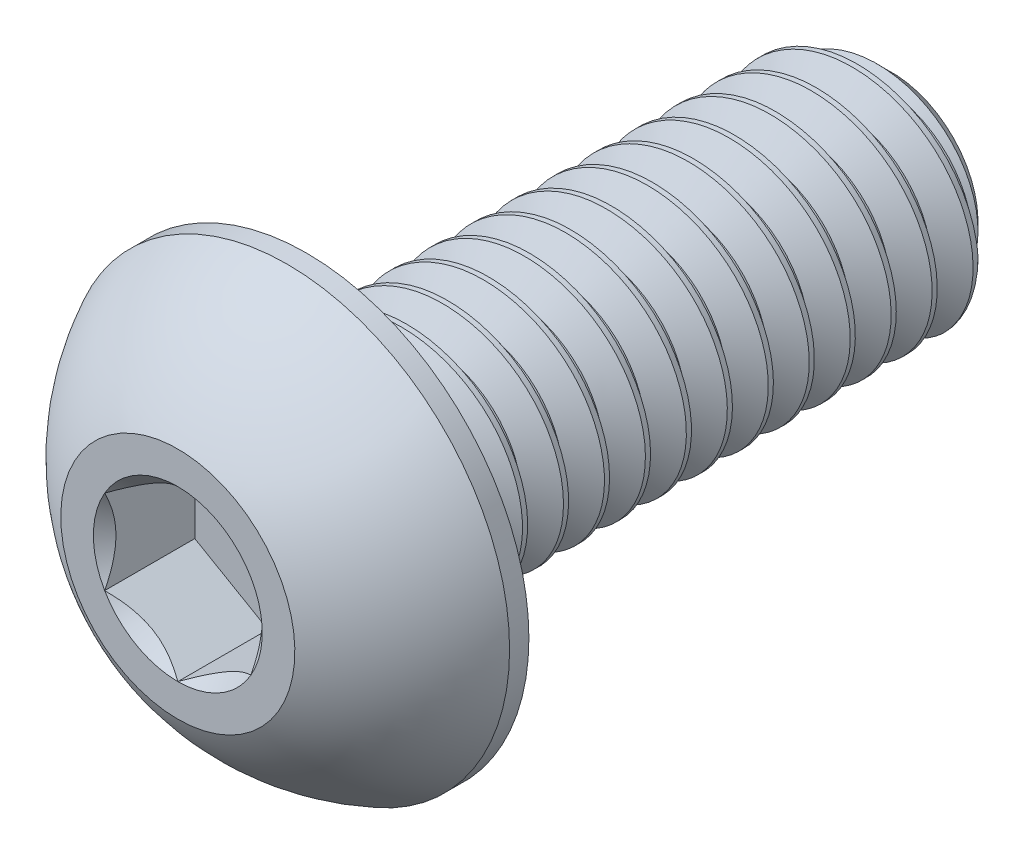
from build123d import *

# Parameters (mm, degrees)
CUT_EXTRUDE2_DEPTH = 1.54
CUT_SWEEP2_PITCH   = 0.7
CUT_SWEEP2_TO      = 10


with BuildPart() as part:
    # Sketch10 → Revolve3 (revolve)
    with BuildSketch(Plane(origin=(0, 0, 0), x_dir=(0, 0, -1), z_dir=(1, 0, 0)), mode=Mode.PRIVATE) as revolve3_sk:
        Polygon((4.475, 2), (5, 1.475), (5, 0), (-5, 0), (-5, 2), align=None)
    revolve(revolve3_sk.sketch.rotate(Axis((0, 0, 7.2), (0, 0, -1)), 180), axis=Axis((0, 0, 7.2), (0, 0, -1)))

    # Sketch7 → Revolve2 (revolve)
    with BuildSketch(Plane(origin=(0, 0, 0), x_dir=(0, 0, -1), z_dir=(1, 0, 0)), mode=Mode.PRIVATE) as revolve2_sk:
        with BuildLine():
            Line((-5.33, 3.8), (-5, 3.8))
            Line((-5, 3.8), (-5, 0))
            Line((-5, 0), (-7.2, 0))
            Line((-7.2, 0), (-7.2, 2))
            ThreePointArc((-7.2, 2), (-6.406499853, 3.047002626), (-5.33, 3.8))
        make_face()
    revolve(revolve2_sk.sketch.rotate(Axis((0, 0, 7.2), (0, 0, -1)), 180), axis=Axis((0, 0, 7.2), (0, 0, -1)))

    # Sketch5 → Cut-Extrude2 (cut)
    with BuildSketch(Plane.XY.offset(7.2)):
        Polygon((1.25, -0.721687836), (1.25, 0.721687836), (0, 1.443375673), (-1.25, 0.721687836), (-1.25, -0.721687836), (0, -1.443375673), align=None)
    extrude(amount=-CUT_EXTRUDE2_DEPTH, mode=Mode.SUBTRACT)

    # Cut-Extrude3 cone 1 section (through the dimple's axis) → Cut-Extrude3 (revolve, cut)
    with BuildSketch(Plane(origin=(0, 0, 7.2), x_dir=(0, -1, 0), z_dir=(1, 0, 0))):
        Polygon((0, 0), (1.443375673, 0), (0, 1.443375673), align=None)
    revolve(axis=Axis((0, 0, 7.2), (0, 0, -1)), mode=Mode.SUBTRACT)


with BuildPart() as body_2:
    # Split1: read off the stored shape, not the designer's step
    # Split1: the piece on the far side of the plane
    add(part.part)
    split(bisect_by=Plane.XY.offset(5), keep=Keep.BOTTOM)

    # Cut-Sweep2: arcs per turn and ends read off the stored shape
    # Cut-Sweep2: the profile of Sketch12 screwed along a right-hand helix through 19 turns, 6 arcs to a turn; built about Z, then put on its axis
    cut_sweep2_z = Axis((0, 0, 0), (0, 0, 1))
    cut_sweep2_corners = [(1.545336663, 0, -0.2625), (1.545336663, 0, -0.35), (2.037888611, 0, -0.634375), (2.037888611, 0, 0.021875)]
    with BuildLine(mode=Mode.PRIVATE) as cut_sweep2_profile:
        Line(cut_sweep2_corners[0], cut_sweep2_corners[1])
        Line(cut_sweep2_corners[1], cut_sweep2_corners[2])
        Line(cut_sweep2_corners[2], cut_sweep2_corners[3])
        Line(cut_sweep2_corners[3], cut_sweep2_corners[0])
    cut_sweep2_cap = Face(cut_sweep2_profile.wire())
    cut_sweep2_turn_angles = [0, 30, 60, 90, 120, 150, 180, 210, 240, 270, 300, 330, 360]
    cut_sweep2_turn_weights = [1, 0.8660254037844387, 1, 0.8660254037844387, 1, 0.8660254037844387, 1, 0.8660254037844387, 1, 0.8660254037844387, 1, 0.8660254037844387, 1]
    cut_sweep2_turn_rails = [Edge.make_bspline([Vector(p[0], p[1], 0).rotate(cut_sweep2_z, cut_sweep2_turn_angles[k]) / cut_sweep2_turn_weights[k] + Vector(0, 0, p[2] + CUT_SWEEP2_PITCH * cut_sweep2_turn_angles[k] / 360) for k in range(13)], [0, 0, 0, 1, 1, 2, 2, 3, 3, 4, 4, 5, 5, 6, 6, 6], 2, cut_sweep2_turn_weights) for p in cut_sweep2_corners]
    cut_sweep2_turn_sides = [Face.make_surface_from_curves(cut_sweep2_turn_rails[p[0]], cut_sweep2_turn_rails[p[1]]) for p in [(0, 1), (1, 2), (2, 3), (3, 0)]]
    cut_sweep2 = Plane(origin=(0, 0, -5), x_dir=(0, 1, 0), z_dir=(0, 0, 1)) * split(Solid(Shell([*[p.moved(Location((0, 0, CUT_SWEEP2_PITCH * i))) for i in range(19) for p in cut_sweep2_turn_sides], cut_sweep2_cap, cut_sweep2_cap.rotate(cut_sweep2_z, 6840).moved(Location((0, 0, CUT_SWEEP2_PITCH * 6840 / 360)))])), bisect_by=Plane.XY.offset(CUT_SWEEP2_TO), keep=Keep.BOTTOM, mode=Mode.PRIVATE)
    add(cut_sweep2, mode=Mode.SUBTRACT)


with BuildPart() as part_1:
    add(part.part)

    # Split1
    split(bisect_by=Plane.XY.offset(5), keep=Keep.TOP)

    add(body_2.part)  # Boss-Extrude1 merges body 2
    # Boss-Extrude1 cone 1 section (through the dimple's axis) → Boss-Extrude1 (revolve)
    with BuildSketch(Plane(origin=(0, 0, 5), x_dir=(0, -1, 0), z_dir=(1, 0, 0))):
        Polygon((0, 0), (2, 0), (0, 2), align=None)
    revolve(axis=Axis((0, 0, 5), (0, 0, -1)))


solid = part_1.part
